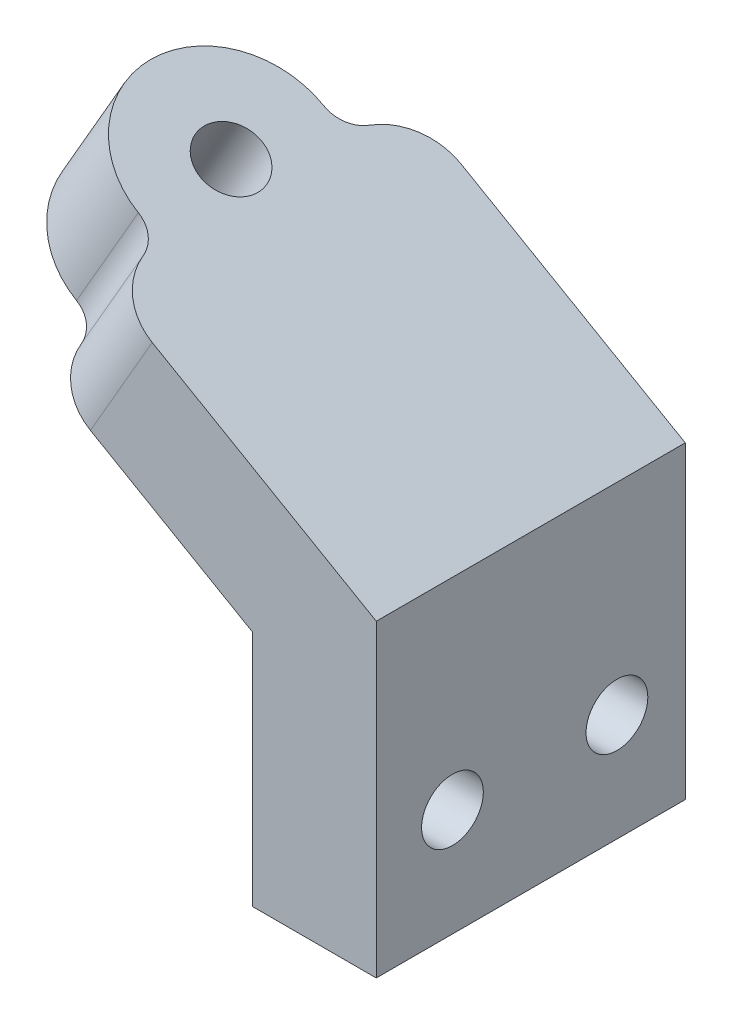
from build123d import *

# Parameters (mm, degrees)
BOSS_EXTRUDE1_DEPTH = 50
CUT_EXTRUDE1_DEPTH  = 110.24284873619861
FILLET1_R           = 10
HOLE1_D             = 10
HOLE2_D             = 10


with BuildPart() as part:
    # Sketch1 → Boss-Extrude1 (new body)
    with BuildSketch(Plane.XY):
        Polygon((-10, 0), (10, 3.67e-15), (9.999999999999991, 50.00000000000001), (-52.35382907247969, 85.99999999999983), (-62.35382907247966, 68.67949192431102), (-10.000000000000009, 38.45299461620743), align=None)
    extrude(amount=BOSS_EXTRUDE1_DEPTH)

    # Sketch2 → Cut-Extrude1 (cut, through all)
    with BuildSketch(Plane(origin=(24.150635094610877, 41.83012701892233, 0), x_dir=(0.86602540378444, -0.4999999999999976, 0), z_dir=(0.4999999999999976, 0.86602540378444, 0))):
        with BuildLine():
            Line((-72.33974596215559, -50), (-88.33974596215548, -50))
            Line((-88.33974596215548, -50), (-88.33974596215548, 0))
            Line((-88.33974596215548, 0), (-72.33974596215559, -6.94e-15))
            ThreePointArc((-72.33974596215559, -6.94e-15), (-67.33974596215559, -5.000000000000008), (-72.33974596215559, -10.000000000000009))
            ThreePointArc((-72.33974596215559, -10.000000000000009), (-87.33974596215559, -25.000000000000007), (-72.33974596215559, -40.000000000000014))
            ThreePointArc((-72.33974596215559, -40.000000000000014), (-67.33974596215559, -45.000000000000014), (-72.33974596215559, -50))
        make_face()
    extrude(amount=-CUT_EXTRUDE1_DEPTH, mode=Mode.SUBTRACT)

    # Fillet1
    fillet1_edges = [part.edges().sort_by_distance(p)[0] for p in [
        (-43.49742261192873, 69.33974596215553, 7.47e-15),
        (-43.49742261192873, 69.33974596215553, 50),
    ]]
    fillet(fillet1_edges, radius=FILLET1_R - 0.0001)  # a hair under: the kernel refuses the full size

    # Hole1 (through all)
    with Locations(Plane(origin=(24.150635094610877, 41.83012701892233, 0), x_dir=(0.86602540378444, -0.4999999999999976, 0), z_dir=(0.4999999999999976, 0.86602540378444, 0))):
        with Locations((-72.339745962, -25)):
            Hole(HOLE1_D / 2)

    # Hole2 (through all)
    with Locations(Plane(origin=(10, 1.73e-15, 0), x_dir=(0, 0, -1), z_dir=(1, 1.7e-16, 0))):
        with Locations((-37.675212833, 17.399574334), (-11.057265884, 17.399574334)):
            Hole(HOLE2_D / 2)


solid = part.part
